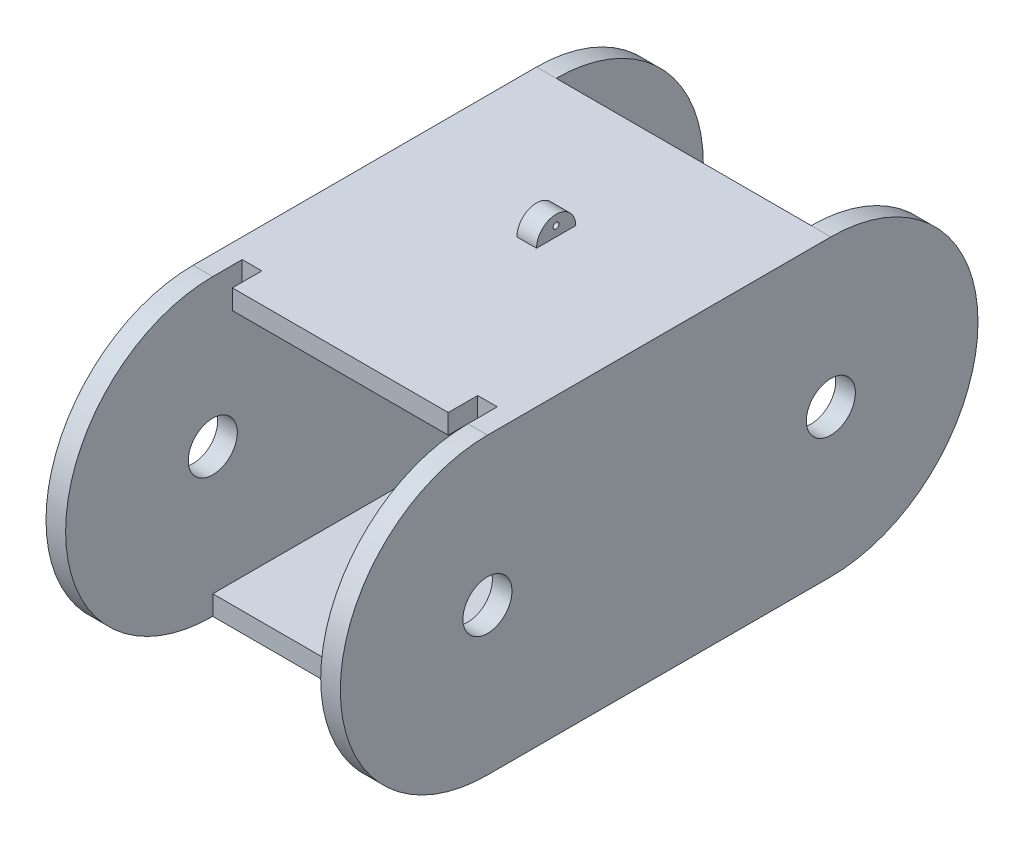
from build123d import *

# Parameters (mm, degrees)
SKETCH1_W           = 19.05
SKETCH1_H           = 41.275
BOSS_EXTRUDE1_DEPTH = 19.05
SKETCH2_W           = 16.51
SKETCH2_H           = 16.51
CUT_EXTRUDE1_DEPTH  = 50.8
SKETCH3_W           = 1.27
SKETCH3_H           = 2.54
BOSS_EXTRUDE2_DEPTH = 1.27
SKETCH4_R           = 0.1905
SKETCH4_R_2         = 1.5875
CUT_EXTRUDE2_DEPTH  = 19.05
CUT_EXTRUDE3_DEPTH  = 12.7
SKETCH8_W           = 16.51
SKETCH8_H           = 5.490944517
SKETCH8_H_2         = 4.751904881
CUT_EXTRUDE4_DEPTH  = 25.4
SKETCH9_W           = 3.81
SKETCH9_H           = 5.08
BOSS_EXTRUDE3_DEPTH = 5.08
CUT_EXTRUDE5_DEPTH  = 25.4


with BuildPart() as part:
    # Sketch1 → Boss-Extrude1 (new body)
    with BuildSketch(Plane(origin=(0, 0, 0), x_dir=(1, 0, 0), z_dir=(0, 1, 0))):
        with Locations((9.525, 20.6375)):
            Rectangle(SKETCH1_W, SKETCH1_H)
    extrude(amount=BOSS_EXTRUDE1_DEPTH)

    # Sketch2 → Cut-Extrude1 (cut)
    with BuildSketch(Plane.XY):
        with Locations((9.525, 9.525)):
            Rectangle(SKETCH2_W, SKETCH2_H)
    extrude(amount=-CUT_EXTRUDE1_DEPTH, mode=Mode.SUBTRACT)

    # Sketch3 → Boss-Extrude2 (add)
    with BuildSketch(Plane(origin=(0, 19.05, 0), x_dir=(1, 0, 0), z_dir=(0, 1, 0))):
        with Locations((9.525, 22.86)):
            Rectangle(SKETCH3_W, SKETCH3_H)
    extrude(amount=BOSS_EXTRUDE2_DEPTH)

    # Sketch4 → Cut-Extrude2 (cut)
    with BuildSketch(Plane(origin=(0, 0, 0), x_dir=(0, 0, -1), z_dir=(1, 0, 0))):
        with Locations((22.86, 19.685)):
            Circle(SKETCH4_R)
        with Locations((9.525, 9.525)):
            Circle(SKETCH4_R_2)
        with BuildLine():
            ThreePointArc((24.13, 19.05), (22.86, 22.337330126), (21.59, 19.05))
            add(Edge.make_bspline(
                [(24.13, 19.05), (24.13, 20.32), (22.86, 20.32), (21.59, 20.32), (21.59, 19.05)],
                knots=[3.141592654, 3.141592654, 3.141592654, 4.71238898, 4.71238898, 6.283185307, 6.283185307, 6.283185307], degree=2, weights=[1, 0.707106781, 1, 0.707106781, 1]))
        make_face()
        with BuildLine():
            ThreePointArc((9.525, 19.05), (0, 9.525), (9.525, 0))
            ThreePointArc((9.525, 0), (-6.861844225, 9.525), (9.525, 19.05))
        make_face()
    cut_extrude2 = extrude(amount=CUT_EXTRUDE2_DEPTH, mode=Mode.SUBTRACT)

    # Mirror1: Cut-Extrude2 across plane
    add(cut_extrude2.mirror(Plane.XY.offset(-20.6375)), mode=Mode.SUBTRACT)

    # Sketch7 → Cut-Extrude3 (cut)
    with BuildSketch(Plane(origin=(0, 19.05, 0), x_dir=(1, 0, 0), z_dir=(0, 1, 0))):
        Polygon((2.54, 9.525), (16.51, 9.525), (16.51, 11.43), (17.78, 11.43), (17.78, 0), (16.51, 0), (2.54, 0), (1.27, 0), (1.27, 11.43), (2.54, 11.43), align=None)
    extrude(amount=-CUT_EXTRUDE3_DEPTH, mode=Mode.SUBTRACT)

    # Sketch8 → Cut-Extrude4 (cut)
    with BuildSketch(Plane(origin=(0, 19.05, 0), x_dir=(1, 0, 0), z_dir=(0, 1, 0))):
        with Locations((9.525, 6.779527742)):
            Rectangle(SKETCH8_W, SKETCH8_H)
        with Locations((9.525, 34.125952441)):
            Rectangle(SKETCH8_W, SKETCH8_H_2)
    extrude(amount=-CUT_EXTRUDE4_DEPTH, mode=Mode.SUBTRACT)

    # Sketch9 → Boss-Extrude3 (add)
    with BuildSketch(Plane(origin=(0, 0, 0), x_dir=(1, 0, 0), z_dir=(0, 1, 0))):
        with Locations((10.16, 24.765)):
            Rectangle(SKETCH9_W, SKETCH9_H)
    extrude(amount=-BOSS_EXTRUDE3_DEPTH)

    # Sketch10 → Cut-Extrude5 (cut)
    with BuildSketch(Plane(origin=(0, 0, 0), x_dir=(0, 0, -1), z_dir=(1, 0, 0))):
        with BuildLine():
            Line((22.225, -2.54), (22.225, 0))
            ThreePointArc((22.225, 0), (24.765, -6.612932383), (27.305, 0))
            Line((27.305, 0), (25.165211157, 0))
            ThreePointArc((25.165211157, 0), (23.774192819, -1.039121584), (22.901226805, -2.54))
            ThreePointArc((22.901226805, -2.54), (23.501666453, -3.82212392), (24.765, -4.461152767))
            ThreePointArc((24.765, -4.461152767), (26.055489938, -3.856329433), (26.679963278, -2.575232796))
            ThreePointArc((26.679963278, -2.575232796), (26.462571766, -2.189951454), (26.048346179, -2.034651919))
            ThreePointArc((26.048346179, -2.034651919), (25.688036915, -1.694231845), (26.028456989, -1.333922582))
            ThreePointArc((26.028456989, -1.333922582), (26.916515307, -1.672580577), (27.305, -2.54))
            ThreePointArc((27.305, -2.54), (26.561051224, -4.336051224), (24.765, -5.08))
            ThreePointArc((24.765, -5.08), (22.968948776, -4.336051224), (22.225, -2.54))
        make_face()
    extrude(amount=CUT_EXTRUDE5_DEPTH, mode=Mode.SUBTRACT)


solid = part.part
